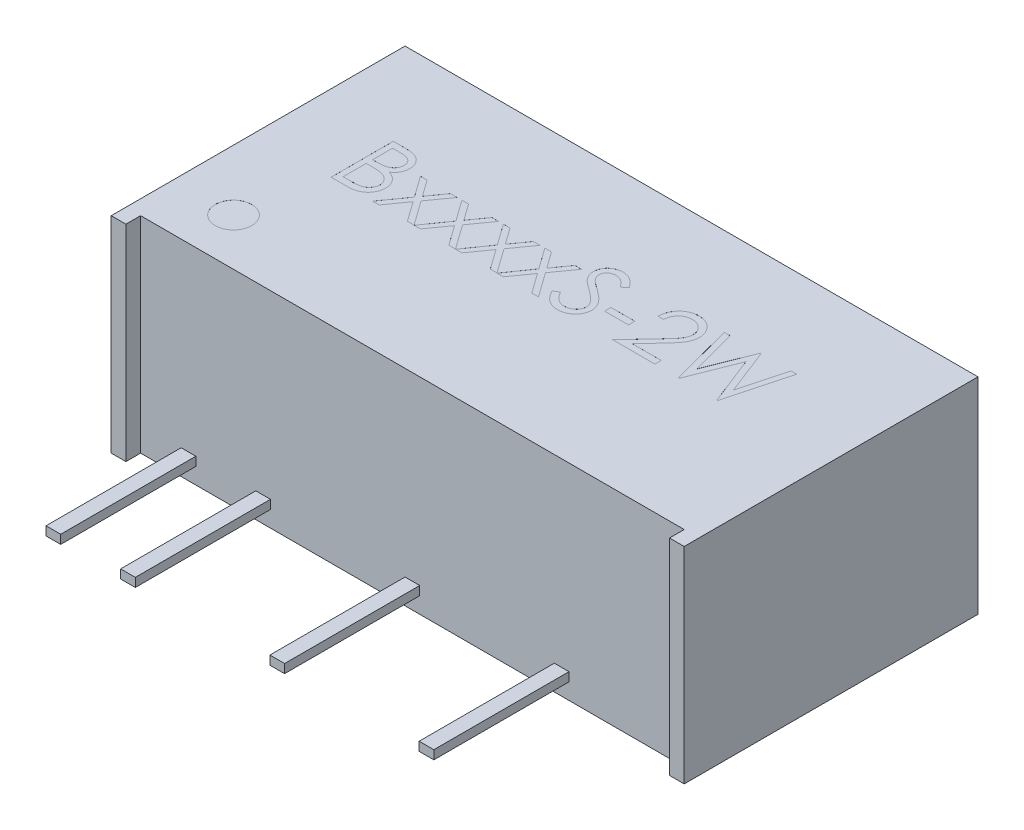
from build123d import *

# Parameters (mm, degrees)
SKETCH_1_W              = 19.5
SKETCH_1_H              = 7
EXTRUDE_1_DEPTH         = 9.5
SKETCH_2_W              = 0.5
SKETCH_2_H              = 0.3
EXTRUDE_2_DEPTH         = 4.6
SKETCH_3_W              = 0.5
SKETCH_3_H              = 7
EXTRUDE_3_DEPTH         = 0.5
SKETCH_4_R              = 0.62255971
CUT_EXTRUDE_1_DEPTH     = 0.001
CUT_EXTRUDE_START       = -0.001
CUT_EXTRUDE_2_OUTLINE_W = 0.814102564
CUT_EXTRUDE_2_OUTLINE_H = 0.217094018
CUT_EXTRUDE_2_DEPTH     = 0.001


# Read off the part's stored shape, not the designer's step: Вырез-Вытянуть2
with BuildPart() as part:
    # Эскиз1 → Бобышка-Вытянуть1 (new body)
    with BuildSketch(Plane.XY):
        with Locations((9.75, -3.5)):
            Rectangle(SKETCH_1_W, SKETCH_1_H)
    extrude(amount=EXTRUDE_1_DEPTH)

    # Эскиз2 → Бобышка-Вытянуть2 (add)
    with BuildSketch(Plane.XY.offset(9.5)):
        with Locations((9.75, -6.3)):
            Rectangle(SKETCH_2_W, SKETCH_2_H)
        with Locations((14.83, -6.3)):
            Rectangle(SKETCH_2_W, SKETCH_2_H)
        with Locations((4.67, -6.3)):
            Rectangle(SKETCH_2_W, SKETCH_2_H)
        with Locations((2.13, -6.300012218)):
            Rectangle(SKETCH_2_W, SKETCH_2_H)
    extrude(amount=EXTRUDE_2_DEPTH)

    # Эскиз3 → Бобышка-Вытянуть3 (add)
    with BuildSketch(Plane.XY.offset(9.5)):
        with Locations((0.25, -3.5)):
            Rectangle(SKETCH_3_W, SKETCH_3_H)
        with Locations((19.25, -3.5)):
            Rectangle(SKETCH_3_W, SKETCH_3_H)
    extrude(amount=EXTRUDE_3_DEPTH)

    # Эскиз4 → Вырез-Вытянуть1 (cut)
    with BuildSketch(Plane(origin=(0, 0, 0), x_dir=(1, 0, 0), z_dir=(0, 1, 0))):
        with Locations(Location((2.062788343, -7.900874573, 0), (0, 0, 270))):
            Circle(SKETCH_4_R)
    extrude(amount=-CUT_EXTRUDE_1_DEPTH, mode=Mode.SUBTRACT)

    # Вырез-Вытянуть2 outline → Вырез-Вытянуть2 (cut)
    # profile 1 of 9: a face of its own
    with BuildSketch(Plane(origin=(0, 0, 0), x_dir=(1, 0, 0), z_dir=(0, 1, 0)).offset(CUT_EXTRUDE_START)):
        with BuildLine():
            add(Edge.make_bspline(
                [(12.949223178, -3.169460848), (12.932670341, -3.169893273), (12.900163302, -3.170742482), (12.852436077, -3.176682855), (12.806906107, -3.186931054), (12.763458861, -3.200947424), (12.722020826, -3.218762832), (12.682793523, -3.240952601), (12.645865014, -3.26743119), (12.611165878, -3.297451907), (12.579195758, -3.330875647), (12.551106457, -3.368135006), (12.526562791, -3.408549681), (12.505148635, -3.452010623), (12.487758289, -3.498912195), (12.474469765, -3.549087902), (12.463954863, -3.602319881), (12.460442091, -3.639080384), (12.458641581, -3.657922387)],
                knots=[0, 0, 0, 0, 0.064438672, 0.126546911, 0.186887153, 0.245877536, 0.304040885, 0.362191218, 0.420975933, 0.480660283, 0.540600275, 0.600689098, 0.66193579, 0.724442506, 0.789038394, 0.856313757, 0.926352028, 1, 1, 1, 1], degree=3))
            add(Edge.make_bspline(
                [(13.408427905, -3.598560741), (13.408043433, -3.584118181), (13.407285711, -3.555654669), (13.400598436, -3.513922615), (13.390492559, -3.473666751), (13.376011379, -3.434763253), (13.356896827, -3.397603263), (13.333629592, -3.362141549), (13.306784173, -3.327858223), (13.275728881, -3.295713133), (13.241613343, -3.266272594), (13.205573011, -3.24019279), (13.16744271, -3.218397709), (13.127383208, -3.200530927), (13.085506186, -3.18651534), (13.04173065, -3.176803723), (12.996177554, -3.17070622), (12.965072535, -3.169881221), (12.949223178, -3.169460848)],
                knots=[0, 0, 0, 0, 0.061965401, 0.122121906, 0.180988497, 0.239933216, 0.299905831, 0.359988847, 0.421775742, 0.486575826, 0.551534805, 0.615017543, 0.677258617, 0.739729962, 0.803050103, 0.866495132, 0.931973474, 1, 1, 1, 1], degree=3))
            add(Edge.make_bspline(
                [(13.008160811, -4.247298722), (13.028146914, -4.226435461), (13.066536128, -4.186361405), (13.12083321, -4.127854948), (13.169600598, -4.073577845), (13.213153974, -4.023632647), (13.250548522, -3.977288794), (13.283733158, -3.936047235), (13.310321872, -3.898095734), (13.339178326, -3.854104982), (13.367126781, -3.800394676), (13.391143301, -3.734757635), (13.405787519, -3.667189249), (13.407544253, -3.621528493), (13.408427905, -3.598560741)],
                knots=[0, 0, 0, 0, 0.110802644, 0.212829202, 0.30610131, 0.390647321, 0.466924469, 0.534481039, 0.593586941, 0.644557005, 0.736200453, 0.825024026, 0.911985585, 1, 1, 1, 1], degree=3))
            Line((13.008160811, -4.247298722), (12.187274059, -5.123307002))
            Line((12.187274059, -5.123307002), (13.625521922, -5.123307002))
            Line((13.625521922, -5.123307002), (13.625521922, -4.906212985))
            Line((13.625521922, -4.906212985), (12.640542622, -4.906212985))
            Line((12.640542622, -4.906212985), (13.170133301, -4.341005319))
            add(Edge.make_bspline(
                [(13.59838517, -3.581600271), (13.597361149, -3.611081105), (13.595331078, -3.669525424), (13.577965717, -3.755410603), (13.550844255, -3.838621861), (13.518188711, -3.905591563), (13.485245852, -3.959556581), (13.455559597, -4.003987655), (13.420807069, -4.051827628), (13.380482453, -4.102916304), (13.335419907, -4.157653851), (13.285211265, -4.216007204), (13.229498493, -4.277373465), (13.190395495, -4.319286852), (13.170133301, -4.341005319)],
                knots=[0, 0, 0, 0, 0.098702196, 0.195672309, 0.292422427, 0.391342544, 0.444462441, 0.504228775, 0.570352338, 0.642545753, 0.722287505, 0.807921123, 0.900469538, 1, 1, 1, 1], degree=3))
            add(Edge.make_bspline(
                [(12.958975448, -2.952366831), (12.982185045, -2.952910183), (13.027791075, -2.953977851), (13.094352388, -2.963146664), (13.157717704, -2.977507093), (13.217763163, -2.997654988), (13.274009688, -3.024738904), (13.326879815, -3.057273605), (13.377002972, -3.094901789), (13.422122312, -3.139202905), (13.463553389, -3.186496728), (13.499296181, -3.236987032), (13.529905094, -3.289135219), (13.555418596, -3.343338941), (13.574200166, -3.400108563), (13.588459368, -3.458617585), (13.59651928, -3.519471638), (13.597756274, -3.560659888), (13.59838517, -3.581600271)],
                knots=[0, 0, 0, 0, 0.06947546, 0.136516798, 0.200788824, 0.263829673, 0.325735023, 0.387290692, 0.449509219, 0.51296782, 0.576275215, 0.6375801, 0.697902606, 0.757172088, 0.816598528, 0.876653171, 0.937289642, 1, 1, 1, 1], degree=3))
            add(Edge.make_bspline(
                [(12.268684316, -3.657922387), (12.269922356, -3.632721421), (12.272353834, -3.583227396), (12.283740466, -3.511064843), (12.300033282, -3.442088846), (12.323069542, -3.376853231), (12.351678577, -3.31478119), (12.385986736, -3.256119276), (12.426623017, -3.201091271), (12.472709947, -3.150207304), (12.522765267, -3.103527202), (12.576774097, -3.06321665), (12.633527994, -3.029157868), (12.692854774, -3.000684927), (12.755423781, -2.979312734), (12.820667224, -2.963454885), (12.888871749, -2.953913953), (12.935341667, -2.952888406), (12.958975448, -2.952366831)],
                knots=[0, 0, 0, 0, 0.068790794, 0.135103289, 0.198978674, 0.2619043, 0.323494969, 0.385195378, 0.446969239, 0.509764777, 0.572250569, 0.633405176, 0.693251163, 0.752583163, 0.812579266, 0.873275085, 0.935549943, 1, 1, 1, 1], degree=3))
            Line((12.268684316, -3.657922387), (12.458641581, -3.657922387))
        make_face()
    # profile 2 of 9: a face of its own
    with BuildSketch(Plane(origin=(0, 0, 0), x_dir=(1, 0, 0), z_dir=(0, 1, 0)).offset(CUT_EXTRUDE_START)):
        with BuildLine():
            add(Edge.make_bspline(
                [(10.361479454, -5.177580506), (10.345492366, -5.177271363), (10.31371953, -5.17665697), (10.266723796, -5.171225434), (10.220677473, -5.163540662), (10.17615836, -5.151340153), (10.132592877, -5.13653741), (10.090170502, -5.118310894), (10.048870674, -5.096468587), (10.008461946, -5.071494929), (9.969047088, -5.042431436), (9.93099579, -5.008580797), (9.893059569, -4.970876611), (9.856358143, -4.928294985), (9.820149146, -4.881523858), (9.785146489, -4.830125638), (9.750625641, -4.774380286), (9.72896581, -4.735152353), (9.717829615, -4.714983685)],
                knots=[0, 0, 0, 0, 0.057208269, 0.11369606, 0.169177916, 0.224159217, 0.278719878, 0.333794217, 0.389241459, 0.445822073, 0.503704281, 0.564293892, 0.627975416, 0.69503826, 0.765372726, 0.839611443, 0.91753775, 1, 1, 1, 1], degree=3))
            add(Edge.make_bspline(
                [(10.966120213, -4.604740629), (10.965722801, -4.623717069), (10.964935694, -4.661301439), (10.955887903, -4.716489033), (10.942631725, -4.770089607), (10.922652064, -4.821440613), (10.898266154, -4.871481493), (10.867322757, -4.918899604), (10.831455729, -4.964744426), (10.790311499, -5.00779349), (10.745289454, -5.04731238), (10.697704553, -5.082466622), (10.647478911, -5.111778418), (10.594884996, -5.13569726), (10.539910726, -5.154404673), (10.48257459, -5.167959123), (10.422782076, -5.176278053), (10.382141785, -5.177141508), (10.361479454, -5.177580506)],
                knots=[0, 0, 0, 0, 0.061484255, 0.121774528, 0.18091956, 0.240256115, 0.300114444, 0.361145948, 0.423500582, 0.488669361, 0.553954105, 0.617581261, 0.680238427, 0.742187389, 0.804663212, 0.868258989, 0.933020257, 1, 1, 1, 1], degree=3))
            add(Edge.make_bspline(
                [(10.467482392, -3.921657697), (10.490454826, -3.938374138), (10.534937759, -3.970743209), (10.598230676, -4.019375549), (10.655618836, -4.066938724), (10.707303726, -4.113128991), (10.753795952, -4.15759598), (10.794579716, -4.200874666), (10.83007058, -4.242654988), (10.868278965, -4.296220308), (10.907321074, -4.362006963), (10.940849986, -4.442608565), (10.961991463, -4.523523482), (10.964756141, -4.577907807), (10.966120213, -4.604740629)],
                knots=[0, 0, 0, 0, 0.09697231, 0.187773439, 0.272396139, 0.351320997, 0.424334774, 0.491908784, 0.55423322, 0.611267658, 0.716347845, 0.814540086, 0.908495456, 1, 1, 1, 1], degree=3))
            add(Edge.make_bspline(
                [(10.182970507, -3.710923856), (10.187603813, -3.715058629), (10.198611488, -3.724881902), (10.2187355, -3.7409639), (10.24531043, -3.760801767), (10.277642333, -3.78534743), (10.316327357, -3.813820505), (10.361369755, -3.845856928), (10.412267444, -3.882496705), (10.448384983, -3.908112932), (10.467482392, -3.921657697)],
                knots=[0, 0, 0, 0, 0.052594282, 0.124951974, 0.218093899, 0.333502411, 0.468789179, 0.624937586, 0.801683048, 1, 1, 1, 1], degree=3))
            add(Edge.make_bspline(
                [(10.04347064, -3.437436276), (10.043708388, -3.448776455), (10.044184273, -3.471475359), (10.050821413, -3.505010266), (10.05934815, -3.538460457), (10.072860122, -3.571675543), (10.091514187, -3.605236417), (10.116010174, -3.639720992), (10.146861082, -3.675433216), (10.17049337, -3.698660532), (10.182970507, -3.710923856)],
                knots=[0, 0, 0, 0, 0.107285214, 0.214745861, 0.32293856, 0.434116163, 0.553412311, 0.686072985, 0.834255992, 1, 1, 1, 1], degree=3))
            add(Edge.make_bspline(
                [(10.353847243, -3.169460848), (10.331981156, -3.170193638), (10.289814466, -3.171606755), (10.229948942, -3.18704027), (10.17606833, -3.211340728), (10.129772255, -3.245397881), (10.09122656, -3.285748196), (10.063343735, -3.332181123), (10.046561492, -3.38345429), (10.044513599, -3.419220911), (10.04347064, -3.437436276)],
                knots=[0, 0, 0, 0, 0.143073084, 0.275902964, 0.402370856, 0.528413645, 0.650356379, 0.765895086, 0.880774131, 1, 1, 1, 1], degree=3))
            add(Edge.make_bspline(
                [(10.767258701, -3.44082837), (10.756889494, -3.427469971), (10.736920827, -3.401744819), (10.706604423, -3.365718357), (10.67803024, -3.332809343), (10.649878332, -3.304225194), (10.623635517, -3.27840057), (10.598164734, -3.256290622), (10.573832531, -3.237678715), (10.543160876, -3.217816181), (10.504626827, -3.198127248), (10.456255226, -3.181466615), (10.405705432, -3.171454744), (10.371276559, -3.170130988), (10.353847243, -3.169460848)],
                knots=[0, 0, 0, 0, 0.098469431, 0.189629101, 0.274184089, 0.352183161, 0.423198873, 0.488550946, 0.548473346, 0.601440164, 0.701198082, 0.799591802, 0.898545098, 1, 1, 1, 1], degree=3))
            Line((10.767258701, -3.44082837), (10.938983461, -3.310656762))
            add(Edge.make_bspline(
                [(10.375047831, -2.952366831), (10.399990691, -2.953227136), (10.44959408, -2.954938008), (10.52255813, -2.969813658), (10.592807706, -2.994427874), (10.649318632, -3.022361015), (10.693546541, -3.050259538), (10.727275765, -3.075671527), (10.761455366, -3.104926949), (10.796361047, -3.138103732), (10.83140135, -3.175506291), (10.867096486, -3.216878469), (10.903529924, -3.261967434), (10.926967992, -3.294155584), (10.938983461, -3.310656762)],
                knots=[0, 0, 0, 0, 0.107232799, 0.213251813, 0.318830447, 0.426793531, 0.483645951, 0.543603822, 0.60830765, 0.67712676, 0.750685636, 0.828713418, 0.912190348, 1, 1, 1, 1], degree=3))
            add(Edge.make_bspline(
                [(9.853513375, -3.446340522), (9.854302716, -3.423946325), (9.855864526, -3.379636592), (9.869072839, -3.314908423), (9.889920731, -3.25310997), (9.91912764, -3.194853054), (9.956778515, -3.14165458), (10.000349176, -3.092902614), (10.052244694, -3.051918757), (10.109184614, -3.01610956), (10.171509181, -2.98808131), (10.236817966, -2.966938241), (10.305214767, -2.954958357), (10.351541424, -2.953239161), (10.375047831, -2.952366831)],
                knots=[0, 0, 0, 0, 0.083785371, 0.165779888, 0.246280008, 0.327460928, 0.408796954, 0.489715241, 0.571376032, 0.655523321, 0.741019483, 0.826546761, 0.911988852, 1, 1, 1, 1], degree=3))
            add(Edge.make_bspline(
                [(9.971812654, -3.768589454), (9.962455448, -3.756130732), (9.944053247, -3.731628982), (9.919762377, -3.693332521), (9.899116312, -3.654129879), (9.882931473, -3.613915714), (9.869302426, -3.57325459), (9.860135487, -3.531615979), (9.854395452, -3.48918672), (9.853807632, -3.460633793), (9.853513375, -3.446340522)],
                knots=[0, 0, 0, 0, 0.133506769, 0.262558979, 0.388264447, 0.512667355, 0.63372227, 0.75539386, 0.877552945, 1, 1, 1, 1], degree=3))
            add(Edge.make_bspline(
                [(10.318654267, -4.056493434), (10.296384517, -4.040631383), (10.253806451, -4.01030435), (10.194262451, -3.965295378), (10.141016514, -3.924145038), (10.094305299, -3.886465945), (10.054149353, -3.852252989), (10.020232242, -3.821834712), (9.993417972, -3.794388463), (9.978507216, -3.776583461), (9.971812654, -3.768589454)],
                knots=[0, 0, 0, 0, 0.181535301, 0.347081672, 0.495567816, 0.628357302, 0.74551967, 0.845830751, 0.930781807, 1, 1, 1, 1], degree=3))
            add(Edge.make_bspline(
                [(10.700264844, -4.394006788), (10.690787854, -4.381883233), (10.670892098, -4.356431346), (10.636688269, -4.318545894), (10.596552571, -4.279467135), (10.551858516, -4.237702849), (10.500978029, -4.195195467), (10.445504723, -4.149917984), (10.384022294, -4.103592269), (10.340903075, -4.072524098), (10.318654267, -4.056493434)],
                knots=[0, 0, 0, 0, 0.090279215, 0.189529918, 0.299197872, 0.418925887, 0.548376285, 0.68813637, 0.839083502, 1, 1, 1, 1], degree=3))
            add(Edge.make_bspline(
                [(10.776162948, -4.601772547), (10.775271341, -4.584149271), (10.773458834, -4.548323727), (10.75813932, -4.495467746), (10.734040014, -4.443160335), (10.711807367, -4.410804808), (10.700264844, -4.394006788)],
                knots=[0, 0, 0, 0, 0.234723374, 0.477158319, 0.728556284, 1, 1, 1, 1], degree=3))
            add(Edge.make_bspline(
                [(10.361479454, -4.960486489), (10.380037699, -4.959969616), (10.416829461, -4.958944913), (10.470993294, -4.949098904), (10.523596574, -4.933972522), (10.573555132, -4.912309387), (10.620179622, -4.886099922), (10.661065576, -4.854442948), (10.696411559, -4.819000147), (10.72532469, -4.779459208), (10.747507378, -4.736934076), (10.764556867, -4.69328481), (10.774018412, -4.647825723), (10.775443686, -4.617218443), (10.776162948, -4.601772547)],
                knots=[0, 0, 0, 0, 0.091263605, 0.180930311, 0.27008822, 0.360156133, 0.448342532, 0.532665842, 0.613833704, 0.693981527, 0.772715977, 0.849335172, 0.923967327, 1, 1, 1, 1], degree=3))
            add(Edge.make_bspline(
                [(9.896762574, -4.607708712), (9.913404556, -4.635566697), (9.94528995, -4.688941521), (9.998479582, -4.761064241), (10.053593295, -4.822364212), (10.111039225, -4.872484827), (10.170466727, -4.911944868), (10.23226375, -4.939886218), (10.296222045, -4.957313022), (10.33974907, -4.959429741), (10.361479454, -4.960486489)],
                knots=[0, 0, 0, 0, 0.159004299, 0.3046461, 0.438546905, 0.562322299, 0.677432543, 0.786897393, 0.893610889, 1, 1, 1, 1], degree=3))
            Line((9.896762574, -4.607708712), (9.717829615, -4.714983685))
        make_face()
    # profile 3 of 9: a face of its own
    with BuildSketch(Plane(origin=(0, 0, 0), x_dir=(1, 0, 0), z_dir=(0, 1, 0)).offset(CUT_EXTRUDE_START)):
        with BuildLine():
            add(Edge.make_bspline(
                [(3.020988001, -3.006640335), (3.041204272, -3.006746623), (3.080388435, -3.006952634), (3.137368764, -3.01014767), (3.190738282, -3.014504175), (3.240512469, -3.02141666), (3.286668322, -3.029757401), (3.329344941, -3.039858023), (3.368406616, -3.051969356), (3.415041462, -3.071228774), (3.468212528, -3.099848023), (3.525784889, -3.142138156), (3.575015072, -3.193864931), (3.617461083, -3.252213965), (3.651207474, -3.316400837), (3.675621288, -3.38489568), (3.691077717, -3.456815019), (3.692667294, -3.506189703), (3.69347064, -3.531142873)],
                knots=[0, 0, 0, 0, 0.062594097, 0.121322939, 0.176680142, 0.228365096, 0.276868446, 0.321879128, 0.364098625, 0.403355696, 0.477967948, 0.550535461, 0.623584457, 0.698174882, 0.77335367, 0.847281125, 0.92281834, 1, 1, 1, 1], degree=3))
            Line((3.020988001, -3.006640335), (2.608000555, -3.006640335))
            Line((2.608000555, -3.006640335), (2.608000555, -5.123307002))
            Line((2.608000555, -5.123307002), (3.18041642, -5.123307002))
            add(Edge.make_bspline(
                [(3.856291153, -4.522482349), (3.855700394, -4.543145172), (3.854538059, -4.583799854), (3.845962552, -4.643523198), (3.831442758, -4.70059757), (3.811442589, -4.755392133), (3.785339665, -4.807800881), (3.753572754, -4.857883188), (3.71569557, -4.905135855), (3.673324216, -4.950083951), (3.62538949, -4.990498851), (3.573672819, -5.026491683), (3.517522902, -5.056092397), (3.457861934, -5.0809578), (3.394020657, -5.099951677), (3.326285747, -5.113239853), (3.254715621, -5.122193375), (3.205603058, -5.122929495), (3.18041642, -5.123307002)],
                knots=[0, 0, 0, 0, 0.061160277, 0.120334558, 0.178180255, 0.235235126, 0.292682961, 0.351186248, 0.41045661, 0.471719854, 0.533761203, 0.595739024, 0.657887515, 0.72129518, 0.786822515, 0.854686154, 0.925477986, 1, 1, 1, 1], degree=3))
            add(Edge.make_bspline(
                [(3.448815859, -3.981443354), (3.472861451, -3.990675043), (3.518866625, -4.008337553), (3.582176737, -4.039564715), (3.636723144, -4.073529419), (3.682925227, -4.110620586), (3.722438952, -4.150600676), (3.756942398, -4.194055912), (3.786383038, -4.241553161), (3.811609425, -4.292597204), (3.831293673, -4.34666683), (3.846035291, -4.40325487), (3.854482272, -4.462158411), (3.855684322, -4.502245283), (3.856291153, -4.522482349)],
                knots=[0, 0, 0, 0, 0.106057493, 0.202914257, 0.290300165, 0.370222566, 0.446383721, 0.5213969, 0.598291083, 0.676142469, 0.7555287, 0.834887172, 0.916646049, 1, 1, 1, 1], degree=3))
            add(Edge.make_bspline(
                [(3.69347064, -3.531142873), (3.692809503, -3.554518466), (3.691510307, -3.600453711), (3.679086829, -3.667639196), (3.659637282, -3.731593505), (3.63260125, -3.792083233), (3.597463376, -3.847741656), (3.555820488, -3.899017765), (3.505578803, -3.943740547), (3.467936463, -3.968743159), (3.448815859, -3.981443354)],
                knots=[0, 0, 0, 0, 0.130569107, 0.256580609, 0.380551617, 0.503622917, 0.625739323, 0.747548582, 0.871766119, 1, 1, 1, 1], degree=3))
        make_face()
        with BuildLine():
            add(Edge.make_bspline(
                [(3.319916287, -4.144263866), (3.309617738, -4.142174363), (3.287288361, -4.137643889), (3.25087711, -4.132861612), (3.209308275, -4.128601028), (3.162485868, -4.125449518), (3.11035065, -4.122191942), (3.052791275, -4.120925074), (2.990042804, -4.119413617), (2.94650456, -4.119304073), (2.92388931, -4.119247173)],
                knots=[0, 0, 0, 0, 0.079306486, 0.171952819, 0.277056507, 0.394730576, 0.526177321, 0.671344767, 0.829285257, 1, 1, 1, 1], degree=3))
            add(Edge.make_bspline(
                [(3.666333888, -4.522482349), (3.666166911, -4.511298282), (3.665835649, -4.489110546), (3.660839944, -4.456504312), (3.653574413, -4.424920094), (3.644181594, -4.394272127), (3.630502202, -4.365114514), (3.614532529, -4.336870585), (3.595808253, -4.309503004), (3.56663202, -4.274903213), (3.524194677, -4.235039115), (3.463895817, -4.196009292), (3.39533257, -4.164532761), (3.345604515, -4.151167839), (3.319916287, -4.144263866)],
                knots=[0, 0, 0, 0, 0.060287398, 0.119602355, 0.177503371, 0.235142664, 0.292132593, 0.350871209, 0.410097863, 0.470731522, 0.594828704, 0.722578824, 0.85669139, 1, 1, 1, 1], degree=3))
            add(Edge.make_bspline(
                [(3.068477318, -4.906212985), (3.087841144, -4.905980909), (3.125162367, -4.905533614), (3.179047397, -4.904073383), (3.228990512, -4.900751864), (3.274763813, -4.895523183), (3.316861563, -4.889851455), (3.354778746, -4.882224632), (3.388822724, -4.873486452), (3.428298139, -4.859979595), (3.472750261, -4.838996491), (3.520653969, -4.80735884), (3.563245063, -4.769668078), (3.599413005, -4.726046049), (3.629054194, -4.67861377), (3.650617255, -4.62833063), (3.663916487, -4.576027477), (3.665526466, -4.540366656), (3.666333888, -4.522482349)],
                knots=[0, 0, 0, 0, 0.072502489, 0.139738989, 0.201795135, 0.259821934, 0.312205989, 0.360773434, 0.404540343, 0.443698099, 0.516840794, 0.587874336, 0.657965418, 0.728969389, 0.79930772, 0.866635778, 0.933116329, 1, 1, 1, 1], degree=3))
            Line((3.068477318, -4.906212985), (2.79795782, -4.906212985))
            Line((2.79795782, -4.906212985), (2.79795782, -4.119247173))
            Line((2.79795782, -4.119247173), (2.92388931, -4.119247173))
        make_face(mode=Mode.SUBTRACT)
        with BuildLine():
            add(Edge.make_bspline(
                [(3.503513375, -3.534958979), (3.503195162, -3.523211012), (3.502570951, -3.500166093), (3.497458715, -3.466571959), (3.488769754, -3.434976928), (3.4776093, -3.404948014), (3.462013284, -3.377424181), (3.443650618, -3.351453772), (3.42146451, -3.327921205), (3.396211278, -3.305926318), (3.367177492, -3.286426056), (3.334380472, -3.269347118), (3.297376496, -3.255594363), (3.256789198, -3.243549832), (3.211993826, -3.235090245), (3.163507311, -3.22804272), (3.110932504, -3.224454824), (3.074559037, -3.223979866), (3.055756965, -3.223734353)],
                knots=[0, 0, 0, 0, 0.057003133, 0.111817869, 0.164402372, 0.215869805, 0.26684111, 0.317478963, 0.369902136, 0.423400449, 0.479718398, 0.539241497, 0.602430689, 0.671029546, 0.744484798, 0.823453971, 0.908740313, 1, 1, 1, 1], degree=3))
            add(Edge.make_bspline(
                [(2.925585357, -3.902153156), (2.944241533, -3.901911298), (2.980289068, -3.901443978), (3.032492053, -3.900105328), (3.080948612, -3.896356987), (3.125575101, -3.892609724), (3.166301246, -3.886516997), (3.203036819, -3.879264618), (3.236358352, -3.87159448), (3.274784648, -3.858550076), (3.318371622, -3.839271673), (3.364837356, -3.809352991), (3.405800583, -3.773717787), (3.440391263, -3.732599443), (3.468701057, -3.687323226), (3.488364114, -3.638611541), (3.501697471, -3.587678414), (3.502901873, -3.552712137), (3.503513375, -3.534958979)],
                knots=[0, 0, 0, 0, 0.072301034, 0.139700332, 0.202288511, 0.260599533, 0.313190329, 0.361738933, 0.405706476, 0.445539985, 0.518831956, 0.58977824, 0.658867479, 0.728430478, 0.797282704, 0.864815377, 0.931363753, 1, 1, 1, 1], degree=3))
            Line((2.925585357, -3.902153156), (2.79795782, -3.902153156))
            Line((2.79795782, -3.902153156), (2.79795782, -3.223734353))
            Line((2.79795782, -3.223734353), (3.055756965, -3.223734353))
        make_face(mode=Mode.SUBTRACT)
    # profile 4 of 9: a face of its own
    with BuildSketch(Plane(origin=(0, 0, 0), x_dir=(1, 0, 0), z_dir=(0, 1, 0)).offset(CUT_EXTRUDE_START)):
        Polygon((13.869752692, -3.006640335), (14.432840298, -5.123307002), (14.459977051, -5.123307002), (15.104474914, -3.504430132), (15.741340566, -5.123307002), (15.768477318, -5.123307002), (16.339197136, -3.006640335), (16.144999754, -3.006640335), (15.728620213, -4.548347066), (15.123979454, -3.006640335), (15.096418691, -3.006640335), (14.480329615, -4.55894736), (14.066070133, -3.006640335), align=None)
    # profile 5 of 9: a face of its own
    with BuildSketch(Plane(origin=(0, 0, 0), x_dir=(1, 0, 0), z_dir=(0, 1, 0)).offset(CUT_EXTRUDE_START)):
        Polygon((9.437557847, -5.123307002), (9.66355611, -5.123307002), (9.071211693, -4.29266798), (9.582145854, -3.57651213), (9.35614759, -3.57651213), (8.958000555, -4.134511596), (8.55985352, -3.57651213), (8.333855256, -3.57651213), (8.845213429, -4.29266798), (8.258251089, -5.131448827), (8.478443263, -5.123307002), (8.958000555, -4.451248375), align=None)
    # profile 6 of 9: a face of its own
    with BuildSketch(Plane(origin=(0, 0, 0), x_dir=(1, 0, 0), z_dir=(0, 1, 0)).offset(CUT_EXTRUDE_START)):
        Polygon((8.026446735, -5.123307002), (8.252444999, -5.123307002), (7.660100582, -4.29266798), (8.171034743, -3.57651213), (7.945036479, -3.57651213), (7.546889444, -4.134511596), (7.148742409, -3.57651213), (6.922744145, -3.57651213), (7.434102318, -4.29266798), (6.847139978, -5.131448827), (7.067332152, -5.123307002), (7.546889444, -4.451248375), align=None)
    # profile 7 of 9: a face of its own
    with BuildSketch(Plane(origin=(0, 0, 0), x_dir=(1, 0, 0), z_dir=(0, 1, 0)).offset(CUT_EXTRUDE_START)):
        Polygon((6.615335624, -5.123307002), (6.841333888, -5.123307002), (6.24898947, -4.29266798), (6.759923632, -3.57651213), (6.533925368, -3.57651213), (6.135778333, -4.134511596), (5.737631297, -3.57651213), (5.511633034, -3.57651213), (6.022991207, -4.29266798), (5.436028867, -5.131448827), (5.656221041, -5.123307002), (6.135778333, -4.451248375), align=None)
    # profile 8 of 9: a face of its own
    with BuildSketch(Plane(origin=(0, 0, 0), x_dir=(1, 0, 0), z_dir=(0, 1, 0)).offset(CUT_EXTRUDE_START)):
        Polygon((5.204224513, -5.123307002), (5.430222777, -5.123307002), (4.837878359, -4.29266798), (5.348812521, -3.57651213), (5.122814257, -3.57651213), (4.724667222, -4.134511596), (4.326520186, -3.57651213), (4.100521922, -3.57651213), (4.611880095, -4.29266798), (4.019111666, -5.123307002), (4.24510993, -5.123307002), (4.724667222, -4.451248375), align=None)
    # profile 9 of 9: a face of its own
    with BuildSketch(Plane(origin=(0, 0, 0), x_dir=(1, 0, 0), z_dir=(0, 1, 0)).offset(CUT_EXTRUDE_START)):
        with Locations((11.617402264, -4.309204438)):
            Rectangle(CUT_EXTRUDE_2_OUTLINE_W, CUT_EXTRUDE_2_OUTLINE_H)
    extrude(amount=CUT_EXTRUDE_2_DEPTH, mode=Mode.SUBTRACT)


solid = part.part
